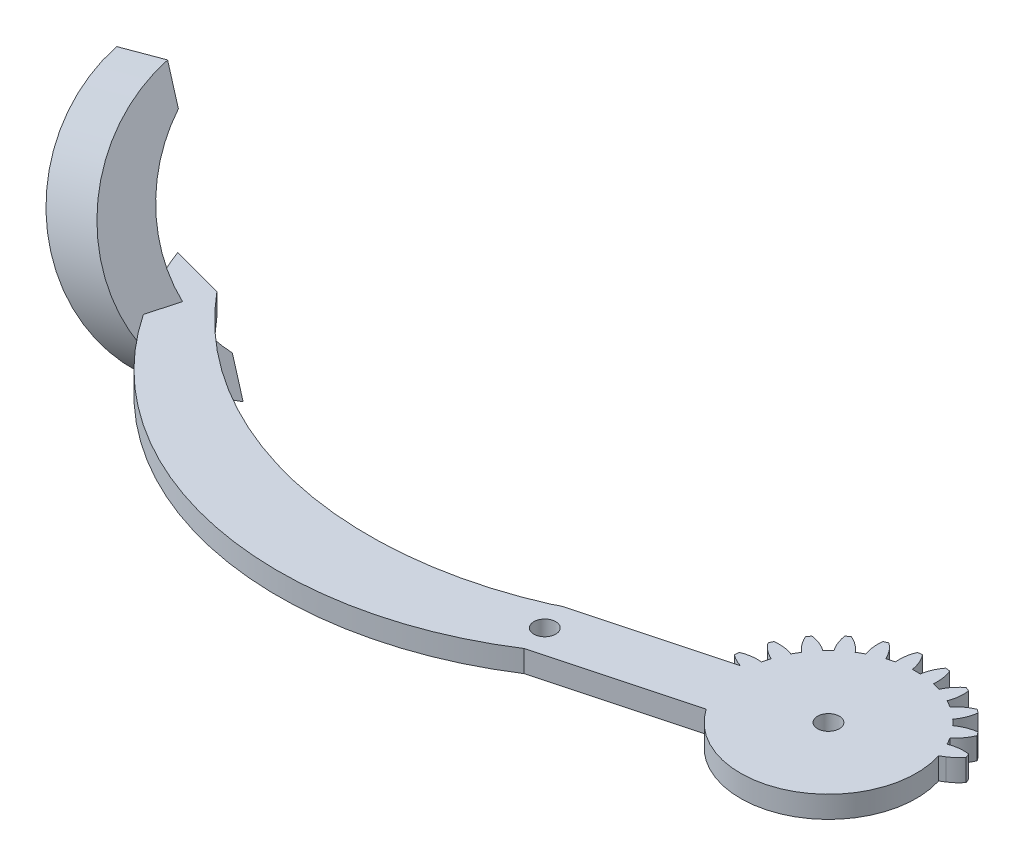
from build123d import *
from build123d.topology import SkipClean

# Parameters (mm, degrees)
SKETCH1_R           = 1.5
BOSS_EXTRUDE1_DEPTH = 3
BOSS_EXTRUDE2_START = -3
SKETCH3_R           = 1.5
BOSS_EXTRUDE2_DEPTH = 3
CUT_EXTRUDE1_START  = -3
CUT_EXTRUDE1_DEPTH  = 3
BOSS_EXTRUDE3_DEPTH = 3
BOSS_EXTRUDE6_START = -25
BOSS_EXTRUDE6_DEPTH = 11


with BuildPart() as part:
    # Sketch1 → Boss-Extrude1 (new body)
    with BuildSketch(Plane(origin=(0, 0, 0), x_dir=(1, 0, 0), z_dir=(0, 1, 0))):
        with BuildLine():
            Line((20.643657446, 4), (2.081641936, 4))
            ThreePointArc((2.081641936, 4), (2.861028333, 4.588201733), (3.521749436, 5.30713988))
            ThreePointArc((3.521749436, 5.30713988), (3.405395609, 5.596745198), (3.282888305, 5.883801663))
            ThreePointArc((3.282888305, 5.883801663), (1.93527598, 5.894040025), (0.627094961, 5.57027124))
            ThreePointArc((0.627094961, 5.57027124), (0.366286148, 6.046375), (0.084372603, 6.510293938))
            ThreePointArc((0.084372603, 6.510293938), (1.018855105, 7.48132754), (1.683794586, 8.65351323))
            ThreePointArc((1.683794586, 8.65351323), (1.496450048, 8.903135899), (1.303821399, 9.148703928))
            ThreePointArc((1.303821399, 9.148703928), (-0.000522033, 8.809805691), (-1.180330337, 8.158486898))
            ThreePointArc((-1.180330337, 8.158486898), (-1.555477026, 8.550865528), (-1.947855656, 8.926012217))
            ThreePointArc((-1.947855656, 8.926012217), (-1.296536862, 10.105820521), (-0.957638625, 11.410163953))
            ThreePointArc((-0.957638625, 11.410163953), (-1.203206655, 11.602792602), (-1.452829324, 11.79013714))
            ThreePointArc((-1.452829324, 11.79013714), (-2.625015014, 11.125197659), (-3.596048616, 10.190715157))
            ThreePointArc((-3.596048616, 10.190715157), (-4.059967554, 10.472628702), (-4.536071314, 10.733437515))
            ThreePointArc((-4.536071314, 10.733437515), (-4.212302529, 12.041618533), (-4.222540891, 13.389230859))
            ThreePointArc((-4.222540891, 13.389230859), (-4.509597355, 13.511738163), (-4.799202674, 13.62809199))
            ThreePointArc((-4.799202674, 13.62809199), (-5.759348103, 12.682425791), (-6.455432668, 11.528463019))
            ThreePointArc((-6.455432668, 11.528463019), (-6.976508546, 11.680699536), (-7.503891752, 11.809396783))
            ThreePointArc((-7.503891752, 11.809396783), (-7.529737283, 13.156800143), (-7.888414517, 14.455843809))
            ThreePointArc((-7.888414517, 14.455843809), (-8.197396993, 14.499881098), (-8.507248835, 14.537314892))
            ThreePointArc((-8.507248835, 14.537314892), (-9.18992168, 13.375367565), (-9.563620196, 12.080565177))
            ThreePointArc((-9.563620196, 12.080565177), (-10.106342554, 12.09275), (-10.649064912, 12.080565177))
            ThreePointArc((-10.649064912, 12.080565177), (-11.022763428, 13.375367565), (-11.705436272, 14.537314892))
            ThreePointArc((-11.705436272, 14.537314892), (-12.015288115, 14.499881098), (-12.324270591, 14.455843809))
            ThreePointArc((-12.324270591, 14.455843809), (-12.682947825, 13.156800143), (-12.708793355, 11.809396783))
            ThreePointArc((-12.708793355, 11.809396783), (-13.236176561, 11.680699536), (-13.757252439, 11.528463019))
            ThreePointArc((-13.757252439, 11.528463019), (-14.453337005, 12.682425791), (-15.413482434, 13.62809199))
            ThreePointArc((-15.413482434, 13.62809199), (-15.703087752, 13.511738163), (-15.990144217, 13.389230859))
            ThreePointArc((-15.990144217, 13.389230859), (-16.000382579, 12.041618533), (-15.676613793, 10.733437515))
            ThreePointArc((-15.676613793, 10.733437515), (-16.152717554, 10.472628702), (-16.616636492, 10.190715157))
            ThreePointArc((-16.616636492, 10.190715157), (-17.587670094, 11.125197659), (-18.759855783, 11.79013714))
            ThreePointArc((-18.759855783, 11.79013714), (-19.009478453, 11.602792602), (-19.255046482, 11.410163953))
            ThreePointArc((-19.255046482, 11.410163953), (-18.916148245, 10.105820521), (-18.264829452, 8.926012217))
            ThreePointArc((-18.264829452, 8.926012217), (-18.657208082, 8.550865528), (-19.032354771, 8.158486898))
            ThreePointArc((-19.032354771, 8.158486898), (-20.212163074, 8.809805691), (-21.516506507, 9.148703928))
            ThreePointArc((-21.516506507, 9.148703928), (-21.709135156, 8.903135899), (-21.896479694, 8.65351323))
            ThreePointArc((-21.896479694, 8.65351323), (-21.231540213, 7.48132754), (-20.297057711, 6.510293938))
            ThreePointArc((-20.297057711, 6.510293938), (-20.578971255, 6.046375), (-20.839780068, 5.57027124))
            ThreePointArc((-20.839780068, 5.57027124), (-22.147961087, 5.894040025), (-23.495573413, 5.883801663))
            ThreePointArc((-23.495573413, 5.883801663), (-23.618080717, 5.596745198), (-23.734434544, 5.30713988))
            ThreePointArc((-23.734434544, 5.30713988), (-22.788768345, 4.346994451), (-21.634805572, 3.650909885))
            ThreePointArc((-21.634805572, 3.650909885), (-21.78704209, 3.129834008), (-21.915739337, 2.602450802))
            ThreePointArc((-21.915739337, 2.602450802), (-23.263142697, 2.576605271), (-24.562186363, 2.217928037))
            ThreePointArc((-24.562186363, 2.217928037), (-24.606223651, 1.908945561), (-24.643657446, 1.599093719))
            ThreePointArc((-24.643657446, 1.599093719), (-23.481710119, 0.916420874), (-22.186907731, 0.542722358))
            ThreePointArc((-22.186907731, 0.542722358), (-22.199092554, 0), (-22.186907731, -0.542722358))
            ThreePointArc((-22.186907731, -0.542722358), (-23.481710119, -0.916420874), (-24.643657446, -1.599093719))
            ThreePointArc((-24.643657446, -1.599093719), (-24.606223651, -1.908945561), (-24.562186363, -2.217928037))
            ThreePointArc((-24.562186363, -2.217928037), (-23.263142697, -2.576605271), (-21.915739337, -2.602450802))
            ThreePointArc((-21.915739337, -2.602450802), (-21.78704209, -3.129834008), (-21.634805572, -3.650909885))
            ThreePointArc((-21.634805572, -3.650909885), (-22.788768345, -4.346994451), (-23.734434544, -5.30713988))
            ThreePointArc((-23.734434544, -5.30713988), (-23.618080717, -5.596745198), (-23.495573413, -5.883801663))
            ThreePointArc((-23.495573413, -5.883801663), (-22.147961087, -5.894040025), (-20.839780068, -5.57027124))
            ThreePointArc((-20.839780068, -5.57027124), (-20.578971255, -6.046375), (-20.297057711, -6.510293938))
            ThreePointArc((-20.297057711, -6.510293938), (-21.231540213, -7.48132754), (-21.896479694, -8.65351323))
            ThreePointArc((-21.896479694, -8.65351323), (-21.709135156, -8.903135899), (-21.516506507, -9.148703928))
            ThreePointArc((-21.516506507, -9.148703928), (-20.212163074, -8.809805691), (-19.032354771, -8.158486898))
            ThreePointArc((-19.032354771, -8.158486898), (-18.657208082, -8.550865528), (-18.264829452, -8.926012217))
            ThreePointArc((-18.264829452, -8.926012217), (-18.916148245, -10.105820521), (-19.255046482, -11.410163953))
            ThreePointArc((-19.255046482, -11.410163953), (-19.009478453, -11.602792602), (-18.759855783, -11.79013714))
            ThreePointArc((-18.759855783, -11.79013714), (-17.587670094, -11.125197659), (-16.616636492, -10.190715157))
            ThreePointArc((-16.616636492, -10.190715157), (-16.152717554, -10.472628702), (-15.676613793, -10.733437515))
            ThreePointArc((-15.676613793, -10.733437515), (-16.000382579, -12.041618533), (-15.990144217, -13.389230859))
            ThreePointArc((-15.990144217, -13.389230859), (-15.703087752, -13.511738163), (-15.413482434, -13.62809199))
            ThreePointArc((-15.413482434, -13.62809199), (-14.453337005, -12.682425791), (-13.757252439, -11.528463019))
            ThreePointArc((-13.757252439, -11.528463019), (-13.236176561, -11.680699536), (-12.708793355, -11.809396783))
            ThreePointArc((-12.708793355, -11.809396783), (-12.682947825, -13.156800143), (-12.324270591, -14.455843809))
            ThreePointArc((-12.324270591, -14.455843809), (-12.015288115, -14.499881098), (-11.705436272, -14.537314892))
            ThreePointArc((-11.705436272, -14.537314892), (-11.022763428, -13.375367565), (-10.649064912, -12.080565177))
            ThreePointArc((-10.649064912, -12.080565177), (-10.106342554, -12.09275), (-9.563620196, -12.080565177))
            ThreePointArc((-9.563620196, -12.080565177), (-9.18992168, -13.375367565), (-8.507248835, -14.537314892))
            ThreePointArc((-8.507248835, -14.537314892), (-8.197396993, -14.499881098), (-7.888414517, -14.455843809))
            ThreePointArc((-7.888414517, -14.455843809), (-7.529737283, -13.156800143), (-7.503891752, -11.809396783))
            ThreePointArc((-7.503891752, -11.809396783), (-6.976508546, -11.680699536), (-6.455432668, -11.528463019))
            ThreePointArc((-6.455432668, -11.528463019), (-5.759348103, -12.682425791), (-4.799202674, -13.62809199))
            ThreePointArc((-4.799202674, -13.62809199), (-4.509597355, -13.511738163), (-4.222540891, -13.389230859))
            ThreePointArc((-4.222540891, -13.389230859), (-4.212302529, -12.041618533), (-4.536071314, -10.733437515))
            ThreePointArc((-4.536071314, -10.733437515), (-4.059967554, -10.472628702), (-3.596048616, -10.190715157))
            ThreePointArc((-3.596048616, -10.190715157), (-2.625015014, -11.125197659), (-1.452829324, -11.79013714))
            ThreePointArc((-1.452829324, -11.79013714), (-1.203206655, -11.602792602), (-0.957638625, -11.410163953))
            ThreePointArc((-0.957638625, -11.410163953), (-1.296536862, -10.105820521), (-1.947855656, -8.926012217))
            ThreePointArc((-1.947855656, -8.926012217), (-1.555477026, -8.550865528), (-1.180330337, -8.158486898))
            ThreePointArc((-1.180330337, -8.158486898), (-0.000522033, -8.809805691), (1.303821399, -9.148703928))
            ThreePointArc((1.303821399, -9.148703928), (1.496450048, -8.903135899), (1.683794586, -8.65351323))
            ThreePointArc((1.683794586, -8.65351323), (1.018855105, -7.48132754), (0.084372603, -6.510293938))
            ThreePointArc((0.084372603, -6.510293938), (0.366286148, -6.046375), (0.627094961, -5.57027124))
            ThreePointArc((0.627094961, -5.57027124), (1.93527598, -5.894040025), (3.282888305, -5.883801663))
            ThreePointArc((3.282888305, -5.883801663), (3.405395609, -5.596745198), (3.521749436, -5.30713988))
            ThreePointArc((3.521749436, -5.30713988), (2.861028333, -4.588201733), (2.081641936, -4))
            Line((2.081641936, -4), (20.643657446, -4))
            ThreePointArc((20.643657446, -4), (24.643657446, 0), (20.643657446, 4))
        make_face()
        with Locations((-10.106342554, 0)):
            Circle(SKETCH1_R, mode=Mode.SUBTRACT)
        with Locations((20.643657446, 0)):
            Circle(SKETCH1_R, mode=Mode.SUBTRACT)
    extrude(amount=BOSS_EXTRUDE1_DEPTH)

    # Sketch3 → Boss-Extrude2 (add)
    with BuildSketch(Plane(origin=(0, 3, 0), x_dir=(1, 0, 0), z_dir=(0, 1, 0)).offset(BOSS_EXTRUDE2_START)):
        with BuildLine():
            Line((-11.141618734, 3.863703305), (-41.891618734, -4.375734362))
            ThreePointArc((-41.891618734, -4.375734362), (-44.720045859, -9.274713848), (-39.821066373, -12.103140972))
            Line((-39.821066373, -12.103140972), (-9.071066373, -3.863703305))
            ThreePointArc((-9.071066373, -3.863703305), (-6.242639249, 1.03527618), (-11.141618734, 3.863703305))
        make_face()
        with Locations((-10.106342554, 0)):
            Circle(SKETCH3_R, mode=Mode.SUBTRACT)
        with Locations((-40.856342554, -8.239437667)):
            Circle(SKETCH3_R, mode=Mode.SUBTRACT)
    extrude(amount=BOSS_EXTRUDE2_DEPTH)

    # Sketch4 → Cut-Extrude1 (cut)
    with SkipClean():  # the faces are left unmerged after this step: merging them gives an invalid solid
        with BuildSketch(Plane(origin=(0, 3, 0), x_dir=(1, 0, 0), z_dir=(0, 1, 0)).offset(CUT_EXTRUDE1_START)):
            with BuildLine():
                ThreePointArc((20.643657446, -4), (24.643657446, 0), (20.643657446, 4))
                Line((20.643657446, 4), (2.081641936, 4))
                Line((2.081641936, 4), (1.43808022, 3.600125745))
                ThreePointArc((1.43808022, 3.600125745), (1.939395696, -1.065266441), (0.627094961, -5.57027124))
                ThreePointArc((0.627094961, -5.57027124), (1.93527598, -5.894040025), (3.282888305, -5.883801663))
                ThreePointArc((3.282888305, -5.883801663), (3.405395609, -5.596745198), (3.521749436, -5.30713988))
                ThreePointArc((3.521749436, -5.30713988), (2.861028333, -4.588201733), (2.081641936, -4))
                Line((2.081641936, -4), (20.643657446, -4))
            make_face()
            with BuildLine():
                ThreePointArc((1.683794586, -8.65351323), (1.018855105, -7.48132754), (0.084372603, -6.510293938))
                ThreePointArc((0.084372603, -6.510293938), (-0.512518948, -7.361599771), (-1.180330337, -8.158486898))
                ThreePointArc((-1.180330337, -8.158486898), (-0.000522033, -8.809805691), (1.303821399, -9.148703928))
                ThreePointArc((1.303821399, -9.148703928), (1.496450048, -8.903135899), (1.683794586, -8.65351323))
            make_face()
            with BuildLine():
                ThreePointArc((-0.957638625, -11.410163953), (-1.296536862, -10.105820521), (-1.947855656, -8.926012217))
                ThreePointArc((-1.947855656, -8.926012217), (-2.744742783, -9.593823606), (-3.596048616, -10.190715157))
                ThreePointArc((-3.596048616, -10.190715157), (-2.625015014, -11.125197659), (-1.452829324, -11.79013714))
                ThreePointArc((-1.452829324, -11.79013714), (-1.203206655, -11.602792602), (-0.957638625, -11.410163953))
            make_face()
            with BuildLine():
                ThreePointArc((-4.222540891, -13.389230859), (-4.212302529, -12.041618533), (-4.536071314, -10.733437515))
                ThreePointArc((-4.536071314, -10.733437515), (-5.478647477, -11.172244217), (-6.455432668, -11.528463019))
                ThreePointArc((-6.455432668, -11.528463019), (-5.759348103, -12.682425791), (-4.799202674, -13.62809199))
                ThreePointArc((-4.799202674, -13.62809199), (-4.509597355, -13.511738163), (-4.222540891, -13.389230859))
            make_face()
            with BuildLine():
                ThreePointArc((-7.888414517, -14.455843809), (-7.529737283, -13.156800143), (-7.503891752, -11.809396783))
                ThreePointArc((-7.503891752, -11.809396783), (-8.527921943, -11.989294847), (-9.563620196, -12.080565177))
                ThreePointArc((-9.563620196, -12.080565177), (-9.18992168, -13.375367565), (-8.507248835, -14.537314892))
                ThreePointArc((-8.507248835, -14.537314892), (-8.197396993, -14.499881098), (-7.888414517, -14.455843809))
            make_face()
            with BuildLine():
                ThreePointArc((-11.705436272, -14.537314892), (-11.022763428, -13.375367565), (-10.649064912, -12.080565177))
                ThreePointArc((-10.649064912, -12.080565177), (-11.684763165, -11.989294847), (-12.708793355, -11.809396783))
                ThreePointArc((-12.708793355, -11.809396783), (-12.682947825, -13.156800143), (-12.324270591, -14.455843809))
                ThreePointArc((-12.324270591, -14.455843809), (-12.015288115, -14.499881098), (-11.705436272, -14.537314892))
            make_face()
            with BuildLine():
                ThreePointArc((-15.413482434, -13.62809199), (-14.453337005, -12.682425791), (-13.757252439, -11.528463019))
                ThreePointArc((-13.757252439, -11.528463019), (-14.734037631, -11.172244217), (-15.676613793, -10.733437515))
                ThreePointArc((-15.676613793, -10.733437515), (-16.000382579, -12.041618533), (-15.990144217, -13.389230859))
                ThreePointArc((-15.990144217, -13.389230859), (-15.703087752, -13.511738163), (-15.413482434, -13.62809199))
            make_face()
            with BuildLine():
                ThreePointArc((-18.759855783, -11.79013714), (-17.587670094, -11.125197659), (-16.616636492, -10.190715157))
                ThreePointArc((-16.616636492, -10.190715157), (-17.467942324, -9.593823606), (-18.264829452, -8.926012217))
                ThreePointArc((-18.264829452, -8.926012217), (-18.916148245, -10.105820521), (-19.255046482, -11.410163953))
                ThreePointArc((-19.255046482, -11.410163953), (-19.009478453, -11.602792602), (-18.759855783, -11.79013714))
            make_face()
            with BuildLine():
                ThreePointArc((-21.516506507, -9.148703928), (-20.212163074, -8.809805691), (-19.032354771, -8.158486898))
                ThreePointArc((-19.032354771, -8.158486898), (-19.58704562, -7.506721784), (-20.094248238, -6.817355984))
                Line((-20.094248238, -6.817355984), (-20.843755363, -7.018185813))
                ThreePointArc((-20.843755363, -7.018185813), (-21.444347002, -7.788065101), (-21.896479694, -8.65351323))
                ThreePointArc((-21.896479694, -8.65351323), (-21.709135156, -8.903135899), (-21.516506507, -9.148703928))
            make_face()
        extrude(amount=CUT_EXTRUDE1_DEPTH, mode=Mode.SUBTRACT)

    # Sketch5 → Boss-Extrude3 (add)
    with SkipClean():  # the faces are left unmerged after this step: merging them gives an invalid solid
        with BuildSketch(Plane(origin=(0, 0, 0), x_dir=(-1, 0, 0), z_dir=(0, -1, 0))):
            with BuildLine():
                ThreePointArc((39.821066373, -12.103140972), (80.892063209, -17.403348445), (110.793618657, 11.246537457))
                Line((110.793618657, 11.246537457), (103.416213105, 9.23996062))
                ThreePointArc((103.416213105, 9.23996062), (75.645449725, -7.978302972), (43.111948314, -4.936069287))
                ThreePointArc((43.111948314, -4.936069287), (44.49145331, -9.908560129), (39.821066373, -12.103140972))
            make_face()
        extrude(amount=-BOSS_EXTRUDE3_DEPTH)

    # Sketch11 → Boss-Extrude6 (add)
    with SkipClean():  # the faces are left unmerged after this step: merging them gives an invalid solid
        with BuildSketch(Plane(origin=(-102.628980864, -48.462754553, -28.163644213), x_dir=(-0.21778196902961164, -0.10283951007051749, 0.9705642941784133), z_dir=(-0.8776345231713191, -0.41443056459664374, -0.24084217003248992)).offset(BOSS_EXTRUDE6_START)):
            with BuildLine():
                Line((14.181191215, 35.527441806), (13.643330831, 40.498428248))
                ThreePointArc((13.643330831, 40.498428248), (17.31755297, 53.468936071), (10.954028908, 65.353360458))
                Line((10.954028908, 65.353360458), (10.416168524, 70.3243469))
                ThreePointArc((10.416168524, 70.3243469), (23.832040201, 54.173803133), (14.181191215, 35.527441806))
            make_face()
        extrude(amount=BOSS_EXTRUDE6_DEPTH)


solid = part.part
